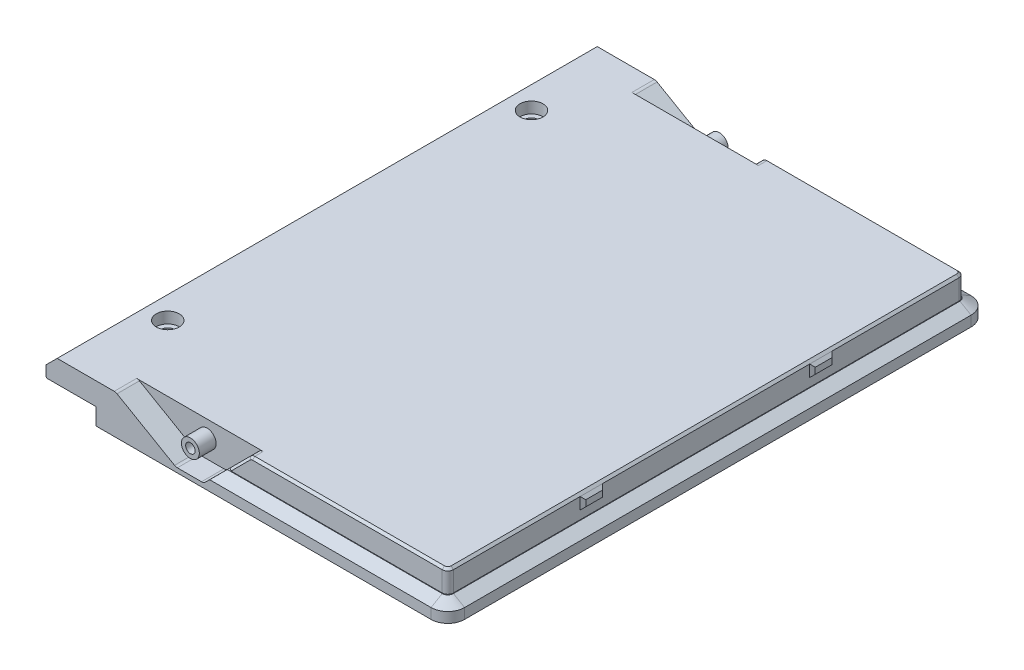
from build123d import *

# Parameters (mm, degrees)
EXTRUDE_1_DEPTH          = 96.5
CUT_EXTRUDE_1_DEPTH      = 97.940548792
CUT_EXTRUDE_1_DEPTH_BACK = 10
SKETCH_2_R               = 1.2
SKETCH_2_3_R             = 2.05
CUT_EXTRUDE_2_DEPTH      = 2
CHAMFER_3_SIZE           = 2
SKETCH_3_W               = 1.8
SKETCH_3_H               = 7.4
CUT_EXTRUDE_3_DEPTH      = 1.9
CHAMFER_4_SIZE           = 0.2
CHAMFER_5_SIZE           = 0.6
SKETCH_5_W               = 96.5
SKETCH_5_H               = 7
EXTRUDE_3_DEPTH          = 62.9
CUT_EXTRUDE_4_DEPTH      = 1
SKETCH_7_W               = 2.1
SKETCH_7_H               = 4
CUT_EXTRUDE_5_DEPTH      = 120.282228349
CUT_EXTRUDE_6_DEPTH      = 2.1
SKETCH_7_4_R             = 1.6
SKETCH_7_4_R_2           = 0.85
CUT_EXTRUDE_7_DEPTH      = 4
CUT_EXTRUDE_START        = -96.5
CUT_EXTRUDE_8_DEPTH      = 2.1
CUT_EXTRUDE_9_DEPTH      = 4
FILLET_1_R               = 3
FILLET_2_R               = 1
CHAMFER_6_SIZE           = 2
CHAMFER_6_SIZE2          = 1.154700538
FILLET_3_R               = 1
EXTRUDE_START            = -4
SKETCH_7_9_R             = 1.6
EXTRUDE_4_DEPTH          = 3
SKETCH_7_10_R            = 0.85
CUT_EXTRUDE_10_DEPTH     = 6
EXTRUDE_START_2          = -92.5
SKETCH_7_11_R            = 1.6
SKETCH_7_11_R_2          = 0.85
EXTRUDE_5_DEPTH          = 3
CUT_EXTRUDE_START_2      = -89.5
SKETCH_7_12_R            = 0.85
CUT_EXTRUDE_11_DEPTH     = 6
SKETCH_8_W               = 46.199999762
SKETCH_8_H               = 76.200000954
CUT_EXTRUDE_12_DEPTH     = 5
CHAMFER_7_SIZE           = 0.4
SKETCH_10_W              = 9.700000238
SKETCH_10_H              = 30
CUT_EXTRUDE_13_DEPTH     = 4
CHAMFER_8_SIZE           = 2
SKETCH_12_W              = 10
SKETCH_12_H              = 10
EXTRUDE_6_DEPTH          = 5
CHAMFER_9_SIZE           = 2
SKETCH_13_R              = 2.3
EXTRUDE_7_DEPTH          = 0.8
SKETCH_14_R              = 0.85
CUT_EXTRUDE_14_DEPTH     = 3
EXTRUDE_START_3          = -0.9
SKETCH_15_W              = 5
SKETCH_15_H              = 4
EXTRUDE_8_DEPTH          = 1.6
CHAMFER_10_SIZE          = 0.5
CHAMFER_11_SIZE          = 0.5


# Read off the part's stored shape, not the designer's step: 切除-拉伸9
# Some blends are built 0.0001 mm under size
with BuildPart() as part:
    # 草图1 → 凸台-拉伸1 (new body)
    with BuildSketch(Plane.XY):
        Polygon((0, 0), (7.1, 0), (7.1, 4), (0, 4), (-1.8, 4), (-1.8, -1.9), (0, -1.9), align=None)
    extrude(amount=-EXTRUDE_1_DEPTH)

    # 草图2 → 切除-拉伸1 (cut, two sides: drawn at the far end of the back side and taken through both)
    with BuildSketch(Plane(origin=(0, 4, 0), x_dir=(1, 0, 0), z_dir=(0, 1, 0)).offset(-CUT_EXTRUDE_1_DEPTH_BACK)):
        with Locations(Location((4.2, 80.75, 0), (0, 0, 90))):
            Circle(SKETCH_2_R)
        with Locations(Location((4.2, 15.75, 0), (0, 0, 90))):
            Circle(SKETCH_2_R)
    extrude(amount=CUT_EXTRUDE_1_DEPTH + CUT_EXTRUDE_1_DEPTH_BACK, mode=Mode.SUBTRACT)

    # 草图2<3> → 切除-拉伸2 (cut)
    with BuildSketch(Plane(origin=(0, 4, 0), x_dir=(1, 0, 0), z_dir=(0, 1, 0))):
        with Locations(Location((4.2, 80.75, 0), (0, 0, 270))):
            Circle(SKETCH_2_3_R)
        with Locations(Location((4.2, 15.75, 0), (0, 0, 270))):
            Circle(SKETCH_2_3_R)
    extrude(amount=-CUT_EXTRUDE_2_DEPTH, mode=Mode.SUBTRACT)

    # 倒角3
    chamfer_3_edges = [part.edges().sort_by_distance(p)[0] for p in [
        (-1.8, 4, -48.25),
    ]]
    chamfer(chamfer_3_edges, length=CHAMFER_3_SIZE)

    # 草图3 → 切除-拉伸3 (cut)
    with BuildSketch(Plane.XZ.offset(1.9)):
        with Locations((-0.9, -92.8)):
            Rectangle(SKETCH_3_W, SKETCH_3_H)
        with Locations((-0.9, -3.7)):
            Rectangle(SKETCH_3_W, SKETCH_3_H)
    extrude(amount=-CUT_EXTRUDE_3_DEPTH, mode=Mode.SUBTRACT)

    # 倒角4
    chamfer_4_edges = [part.edges().sort_by_distance(p)[0] for p in [
        (-1.8, -1.9, -48.25),
        (0, -1.9, -48.25),
        (-1.8, -0.95, -89.1),
        (0, -0.95, -89.1),
        (-1.8, 0, -92.8),
        (-1.8, -0.95, -7.4),
        (0, -0.95, -7.4),
        (-1.8, 0, -3.7),
    ]]
    chamfer(chamfer_4_edges, length=CHAMFER_4_SIZE)

    # 倒角5
    # the kernel refuses this chamfer: 0.6 mm, written as the material it takes off along each edge
    with BuildSketch(Plane(origin=(1.343009793, -1.9, -89.1), x_dir=(0, 0.9996219169112965, -0.027495876610595982), z_dir=(-1, 0, 0))) as chamfer_5_piece_1:
        Polygon((CHAMFER_5_SIZE * 0.999621916911, -CHAMFER_5_SIZE * 0.0274958766106), (-CHAMFER_5_SIZE * 0.0274958766106, -CHAMFER_5_SIZE * 0.999621916911), (0, 0), align=None)
    extrude(amount=4.486019586, mode=Mode.SUBTRACT)
    with BuildSketch(Plane(origin=(1.343009793, -1.9, -7.4), x_dir=(0, 0.9996219169112968, 0.027495876610585925), z_dir=(-1, 0, 0))) as chamfer_5_piece_2:
        Polygon((CHAMFER_5_SIZE * 0.999621916911, CHAMFER_5_SIZE * 0.0274958766106), (-CHAMFER_5_SIZE * 0.0274958766106, CHAMFER_5_SIZE * 0.999621916911), (0, 0), align=None)
    extrude(amount=4.486019586, mode=Mode.SUBTRACT)

    # 草图5 → 凸台-拉伸3 (add)
    with BuildSketch(Plane(origin=(7.1, 0, 0), x_dir=(0, 0, -1), z_dir=(1, 0, 0))):
        with Locations((48.25, 0.5)):
            Rectangle(SKETCH_5_W, SKETCH_5_H)
    extrude(amount=EXTRUDE_3_DEPTH)

    # 草图6 → 切除-拉伸4 (cut)
    with BuildSketch(Plane.XZ.offset(3)):
        with BuildLine():
            Line((61.9, -5.9), (17.900000238, -5.9))
            Line((17.900000238, -5.9), (14.800000238, -5.9))
            ThreePointArc((14.800000238, -5.9), (13.385786676, -6.485786438), (12.800000238, -7.9))
            Line((12.800000238, -7.9), (12.800000238, -11))
            Line((12.800000238, -11), (12.800000238, -85.000000954))
            Line((12.800000238, -85.000000954), (12.800000238, -88.100000954))
            ThreePointArc((12.800000238, -88.100000954), (13.385786676, -89.514214516), (14.800000238, -90.100000954))
            Line((14.800000238, -90.100000954), (17.900000238, -90.100000954))
            Line((17.900000238, -90.100000954), (61.9, -90.100000954))
            Line((61.9, -90.100000954), (65, -90.100000954))
            ThreePointArc((65, -90.100000954), (66.414213562, -89.514214516), (67, -88.100000954))
            Line((67, -88.100000954), (67, -85.000000954))
            Line((67, -85.000000954), (67, -11))
            Line((67, -11), (67, -7.9))
            ThreePointArc((67, -7.9), (66.414213562, -6.485786438), (65, -5.9))
            Line((65, -5.9), (61.9, -5.9))
        make_face()
    extrude(amount=-CUT_EXTRUDE_4_DEPTH, mode=Mode.SUBTRACT)

    # 草图7 → 切除-拉伸5 (cut, through all)
    with BuildSketch(Plane(origin=(0, 0, -96.5), x_dir=(-1, 0, 0), z_dir=(0, 0, -1))):
        with Locations((-68.95, 2)):
            Rectangle(SKETCH_7_W, SKETCH_7_H)
    extrude(amount=-CUT_EXTRUDE_5_DEPTH, mode=Mode.SUBTRACT)

    # 草图7<3> → 切除-拉伸6 (cut)
    with BuildSketch(Plane(origin=(0, 0, -96.5), x_dir=(-1, 0, 0), z_dir=(0, 0, -1))):
        Polygon((-32.6, 4), (-67.9, 4), (-67.9, 0), (-28.6, 0), align=None)
    extrude(amount=-CUT_EXTRUDE_6_DEPTH, mode=Mode.SUBTRACT)

    # 草图7<4> → 切除-拉伸7 (cut)
    # profile 1 of 3: a face of its own
    with BuildSketch(Plane(origin=(0, 0, -96.5), x_dir=(-1, 0, 0), z_dir=(0, 0, -1))):
        Polygon((-10.661284993, 4), (-32.6, 4), (-28.6, 0), (-26.4, -2.2), (-21.4, -2.2), align=None)
        with Locations((-23, 1)):
            Circle(SKETCH_7_4_R, mode=Mode.SUBTRACT)
    # profile 2 of 3: a face of its own
    with BuildSketch(Plane(origin=(0, 0, -96.5), x_dir=(-1, 0, 0), z_dir=(0, 0, -1))):
        with Locations((-23, 1)):
            Circle(SKETCH_7_4_R)
        with Locations((-23, 1)):
            Circle(SKETCH_7_4_R_2, mode=Mode.SUBTRACT)
    # profile 3 of 3: a face of its own
    with BuildSketch(Plane(origin=(0, 0, -96.5), x_dir=(-1, 0, 0), z_dir=(0, 0, -1))):
        with Locations((-23, 1)):
            Circle(SKETCH_7_4_R_2)
    extrude(amount=-CUT_EXTRUDE_7_DEPTH, mode=Mode.SUBTRACT)

    # 草图7<5> → 切除-拉伸8 (cut)
    with BuildSketch(Plane(origin=(0, 0, -96.5), x_dir=(-1, 0, 0), z_dir=(0, 0, -1)).offset(CUT_EXTRUDE_START)):
        Polygon((-32.6, 4), (-67.9, 4), (-67.9, 0), (-28.6, 0), align=None)
    extrude(amount=CUT_EXTRUDE_8_DEPTH, mode=Mode.SUBTRACT)

    # 切除-拉伸9 outline → 切除-拉伸9 (cut)
    with BuildSketch(Plane(origin=(0, 0, -96.5), x_dir=(-1, 0, 0), z_dir=(0, 0, -1)).offset(CUT_EXTRUDE_START)):
        Polygon((-10.661284993, 4), (-32.6, 4), (-26.4, -2.2), (-21.4, -2.2), align=None)
    extrude(amount=CUT_EXTRUDE_9_DEPTH, mode=Mode.SUBTRACT)

    # 圆角1
    fillet_1_edges = [part.edges().sort_by_distance(p)[0] for p in [
        (70, -1.5, -96.5),
        (70, -1.5, 0),
    ]]
    fillet(fillet_1_edges, radius=FILLET_1_R)

    # 圆角2
    fillet_2_edges = [part.edges().sort_by_distance(p)[0] for p in [
        (67.9, 2, -94.4),
        (67.9, 2, -2.1),
    ]]
    fillet(fillet_2_edges, radius=FILLET_2_R)

    # 倒角6
    chamfer_6_edges = [part.edges().sort_by_distance(p)[0] for p in [
        (47.8, 0, -96.5),
        (47.8, 0, 0),
        (70, 0, -48.25),
        (69.121320344, 0, -95.621320344),
        (69.121320344, 0, -0.878679656),
    ]]
    chamfer_6_side = [part.faces().sort_by_distance(p)[0] for p in [
        (47.75, 0, -1.049942383),
    ]]
    chamfer(chamfer_6_edges, length=CHAMFER_6_SIZE, length2=CHAMFER_6_SIZE2, reference=chamfer_6_side[0])

    # 圆角3
    fillet_3_edges = [part.edges().sort_by_distance(p)[0] for p in [
        (26.4, -2.2, -94.5),
        (32.6, 4, -93.45),
        (10.661284993, 4, -94.5),
        (21.4, -2.2, -94.5),
        (26.4, -2.2, -2),
        (21.4, -2.2, -2),
        (10.661284993, 4, -2),
        (32.6, 4, -3.05),
    ]]
    fillet(fillet_3_edges, radius=FILLET_3_R)

    # 草图7<9> → 凸台-拉伸4 (add)
    with BuildSketch(Plane(origin=(0, 0, -96.5), x_dir=(-1, 0, 0), z_dir=(0, 0, -1)).offset(EXTRUDE_START)):
        with Locations((-23, 1)):
            Circle(SKETCH_7_9_R)
    extrude(amount=EXTRUDE_4_DEPTH)

    # 草图7<10> → 切除-拉伸10 (cut)
    with BuildSketch(Plane(origin=(0, 0, -96.5), x_dir=(-1, 0, 0), z_dir=(0, 0, -1))):
        with Locations((-23, 1)):
            Circle(SKETCH_7_10_R)
    extrude(amount=-CUT_EXTRUDE_10_DEPTH, mode=Mode.SUBTRACT)

    # 草图7<11> → 凸台-拉伸5 (add)
    # profile 1 of 2: a face of its own
    with BuildSketch(Plane(origin=(0, 0, -96.5), x_dir=(-1, 0, 0), z_dir=(0, 0, -1)).offset(EXTRUDE_START_2)):
        with Locations((-23, 1)):
            Circle(SKETCH_7_11_R)
        with Locations((-23, 1)):
            Circle(SKETCH_7_11_R_2, mode=Mode.SUBTRACT)
    # profile 2 of 2: a face of its own
    with BuildSketch(Plane(origin=(0, 0, -96.5), x_dir=(-1, 0, 0), z_dir=(0, 0, -1)).offset(EXTRUDE_START_2)):
        with Locations((-23, 1)):
            Circle(SKETCH_7_11_R_2)
    extrude(amount=-EXTRUDE_5_DEPTH)

    # 草图7<12> → 切除-拉伸11 (cut)
    with BuildSketch(Plane(origin=(0, 0, -96.5), x_dir=(-1, 0, 0), z_dir=(0, 0, -1)).offset(CUT_EXTRUDE_START_2)):
        with Locations((-23, 1)):
            Circle(SKETCH_7_12_R)
    extrude(amount=-CUT_EXTRUDE_11_DEPTH, mode=Mode.SUBTRACT)

    # 草图8 → 切除-拉伸12 (cut)
    with BuildSketch(Plane.XZ.offset(2)):
        with Locations((39.900000119, -48.000000477)):
            Rectangle(SKETCH_8_W, SKETCH_8_H)
    extrude(amount=-CUT_EXTRUDE_12_DEPTH, mode=Mode.SUBTRACT)

    # 倒角7
    chamfer_7_edges = [part.edges().sort_by_distance(p)[0] for p in [
        (30.453553391, 1.853553391, -94.4),
        (30.453553391, 1.853553391, -2.1),
        (67.9, 4, -48.25),
        (67.607106781, 4, -94.107106781),
        (67.607106781, 4, -2.392893219),
        (49.957106781, 4, -2.1),
        (49.957106781, 4, -94.4),
        (32.63153013, 3.923879533, -2.1),
        (32.63153013, 3.923879533, -94.4),
    ]]
    chamfer(chamfer_7_edges, length=CHAMFER_7_SIZE)

    # 草图10 → 切除-拉伸13 (cut)
    with BuildSketch(Plane.XZ.offset(3)):
        with Locations((11.950000119, -48.25)):
            Rectangle(SKETCH_10_W, SKETCH_10_H)
    extrude(amount=-CUT_EXTRUDE_13_DEPTH, mode=Mode.SUBTRACT)

    # 倒角8
    chamfer_8_edges = [part.edges().sort_by_distance(p)[0] for p in [
        (16.800000238, 1, -48.25),
    ]]
    chamfer(chamfer_8_edges, length=CHAMFER_8_SIZE - 0.0001)  # a hair under: the kernel refuses the full size

    # 草图12 → 凸台-拉伸6 (add)
    with BuildSketch(Plane.XZ.offset(-3)):
        with Locations((17.800000238, -85.100000954)):
            Rectangle(SKETCH_12_W, SKETCH_12_H)
    extrude(amount=EXTRUDE_6_DEPTH)

    # 倒角9
    # the kernel refuses this chamfer: 2 mm, written as the material it takes off along each edge
    with BuildSketch(Plane(origin=(17.943366214, -3, -33.25), x_dir=(0, 0.9996219169112968, -0.027495876610585623), z_dir=(-1, 0, 0)), Plane(origin=(1.956634024, -3, -63.25), x_dir=(0, 0.9996219169112968, 0.027495876610585623), z_dir=(1, 0, 0))) as chamfer_9_piece_1:
        Polygon((CHAMFER_9_SIZE * 0.999621916911, -CHAMFER_9_SIZE * 0.0274958766106), (-CHAMFER_9_SIZE * 0.0274958766106, -CHAMFER_9_SIZE * 0.999621916911), (0, 0), align=None)
    extrude(amount=15.98673219, mode=Mode.SUBTRACT)
    with BuildSketch(Plane(origin=(22.800000238, 3, -80.100000954), x_dir=(0.02749587661058555, 0, -0.9996219169112968), z_dir=(0, -1, 0))) as chamfer_9_piece_2:
        Polygon((CHAMFER_9_SIZE * 0.999621916911, -CHAMFER_9_SIZE * 0.0274958766106), (-CHAMFER_9_SIZE * 0.0274958766106, -CHAMFER_9_SIZE * 0.999621916911), (0, 0), align=None)
    extrude(amount=10.143365976, mode=Mode.SUBTRACT)

    # 草图13 → 凸台-拉伸7 (add)
    with BuildSketch(Plane.XZ.offset(2)):
        with Locations(Location((17.9, -85.000000954, 0), (0, 0, 90))):
            Circle(SKETCH_13_R)
    extrude(amount=EXTRUDE_7_DEPTH)

    # 草图14 → 切除-拉伸14 (cut)
    with BuildSketch(Plane.XZ.offset(3)):
        with Locations(Location((56.4, -93.1, 0), (0, 0, 270))):
            Circle(SKETCH_14_R)
        with Locations(Location((56.4, -3.2, 0), (0, 0, 270))):
            Circle(SKETCH_14_R)
    extrude(amount=-CUT_EXTRUDE_14_DEPTH, mode=Mode.SUBTRACT)

    # 草图15 → 凸台-拉伸8 (add)
    with BuildSketch(Plane(origin=(0, 4, 0), x_dir=(1, 0, 0), z_dir=(0, 1, 0)).offset(EXTRUDE_START_3)):
        with Locations((65.9, 68.75)):
            Rectangle(SKETCH_15_W, SKETCH_15_H)
        with Locations((65.9, 27.75)):
            Rectangle(SKETCH_15_W, SKETCH_15_H)
    extrude(amount=-EXTRUDE_8_DEPTH)

    # 倒角10
    chamfer_10_edges = [part.edges().sort_by_distance(p)[0] for p in [
        (68.4, 2.3, -66.75),
        (68.4, 2.3, -70.75),
        (68.4, 1.5, -68.75),
        (68.4, 2.3, -25.75),
        (68.4, 2.3, -29.75),
        (68.4, 1.5, -27.75),
    ]]
    chamfer(chamfer_10_edges, length=CHAMFER_10_SIZE - 0.0001)  # a hair under: the kernel refuses the full size

    # 倒角11
    # the kernel refuses this chamfer: 0.5 mm, written as the material it adds along each edge
    with BuildSketch(Plane(origin=(67.9, 3.1, -25.75), x_dir=(0.9996219169112968, -0.027495876610586605, 0), z_dir=(0, 0, -1))) as chamfer_11_piece_1_section:
        Polygon((CHAMFER_11_SIZE * 0.999621916911, -CHAMFER_11_SIZE * 0.0274958766106), (-CHAMFER_11_SIZE * 0.0274958766106, -CHAMFER_11_SIZE * 0.999621916911), (0, 0), align=None)
    chamfer_11_piece_1 = extrude(amount=4, mode=Mode.PRIVATE)
    chamfer_11_piece_1 = split(chamfer_11_piece_1, bisect_by=Plane(origin=(68.977946119, 3.269743637, -28.672153881), z_dir=(-0.70710678118655, 0, 0.707106781186545)), keep=Keep.TOP, mode=Mode.PRIVATE)
    chamfer_11_piece_1 = split(chamfer_11_piece_1, bisect_by=Plane(origin=(68.4, 3.269743637, -27.75), z_dir=(-1, 0, 0)), keep=Keep.TOP, mode=Mode.PRIVATE)
    chamfer_11_piece_1 = split(chamfer_11_piece_1, bisect_by=Plane(origin=(68.977946119, 3.269743637, -26.827846119), z_dir=(-0.70710678118655, 0, -0.707106781186545)), keep=Keep.TOP, mode=Mode.PRIVATE)
    add(chamfer_11_piece_1)
    with BuildSketch(Plane(origin=(67.9, 3.1, -66.75), x_dir=(-0.02749587661058217, 0.9996219169112968, 0), z_dir=(0, 0, -1))) as chamfer_11_piece_2_section:
        Polygon((CHAMFER_11_SIZE * 0.999621916911, CHAMFER_11_SIZE * 0.0274958766106), (-CHAMFER_11_SIZE * 0.0274958766106, CHAMFER_11_SIZE * 0.999621916911), (0, 0), align=None)
    chamfer_11_piece_2 = extrude(amount=4, mode=Mode.PRIVATE)
    chamfer_11_piece_2 = split(chamfer_11_piece_2, bisect_by=Plane(origin=(68.977946119, 3.269743637, -69.672153881), z_dir=(-0.7071067811865476, 0, 0.7071067811865476)), keep=Keep.TOP, mode=Mode.PRIVATE)
    chamfer_11_piece_2 = split(chamfer_11_piece_2, bisect_by=Plane(origin=(68.4, 3.269743637, -68.75), z_dir=(-1, 0, 0)), keep=Keep.TOP, mode=Mode.PRIVATE)
    chamfer_11_piece_2 = split(chamfer_11_piece_2, bisect_by=Plane(origin=(68.977946119, 3.269743637, -67.827846119), z_dir=(-0.7071067811865476, 0, -0.7071067811865476)), keep=Keep.TOP, mode=Mode.PRIVATE)
    add(chamfer_11_piece_2)


solid = part.part
